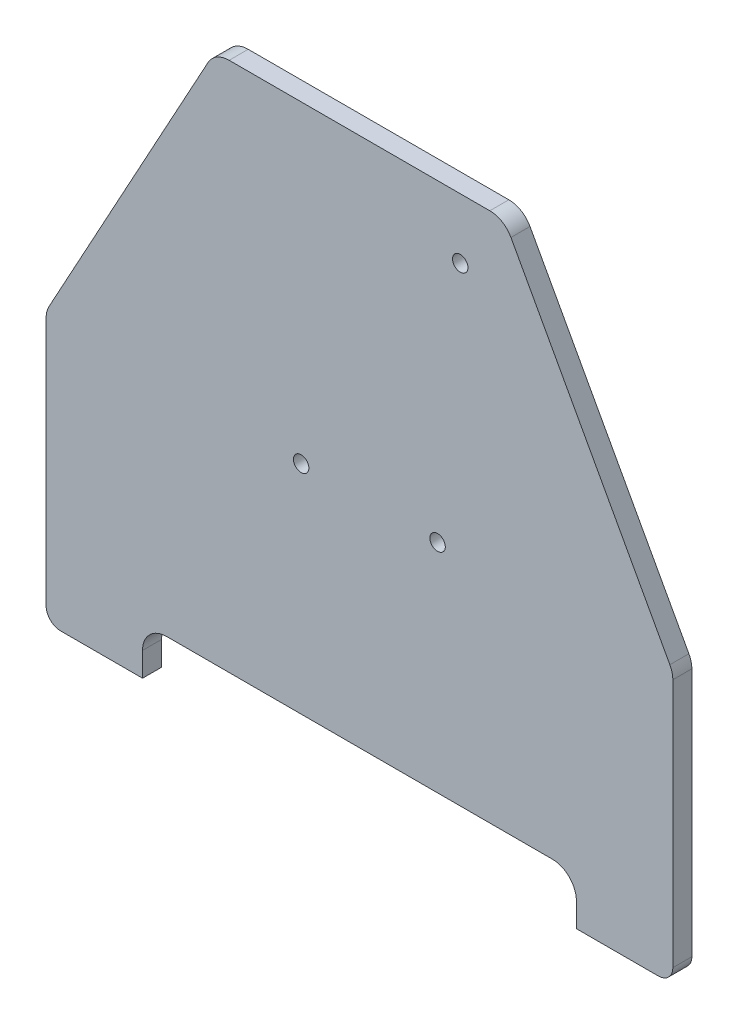
from build123d import *

# Parameters (mm, degrees)
BOSS_EXTRUDE2_DEPTH = 3.95
FILLET1_R           = 5
FILLET2_R           = 3
SKETCH2_R           = 1.6
CUT_EXTRUDE1_DEPTH  = 177.962149908


with BuildPart() as part:
    # Sketch1 → Boss-Extrude2 (new body)
    with BuildSketch(Plane.XY):
        Polygon((0, 56), (35, 120), (95, 120), (130, 56), (130, 0), (110, 0), (110, 10), (20, 10), (20, 0), (0, 0), align=None)
    extrude(amount=BOSS_EXTRUDE2_DEPTH)

    # Fillet1
    fillet1_edges = [part.edges().sort_by_distance(p)[0] for p in [
        (130, 56, 1.975),
        (95, 120, 1.975),
        (35, 120, 1.975),
        (0, 56, 1.975),
        (110, 10, 1.975),
        (20, 10, 1.975),
    ]]
    fillet(fillet1_edges, radius=FILLET1_R)

    # Fillet2
    fillet2_edges = [part.edges().sort_by_distance(p)[0] for p in [
        (130, 0, 1.975),
        (0, 0, 1.975),
    ]]
    fillet(fillet2_edges, radius=FILLET2_R)

    # Sketch2 → Cut-Extrude1 (cut, through all)
    with BuildSketch(Plane.XY.offset(3.95)):
        with Locations((81.203533569, 55)):
            Circle(SKETCH2_R)
        with Locations((85.9, 107.490315326)):
            Circle(SKETCH2_R)
        with Locations((52.903533569, 55)):
            Circle(SKETCH2_R)
    extrude(amount=-CUT_EXTRUDE1_DEPTH, mode=Mode.SUBTRACT)


solid = part.part
